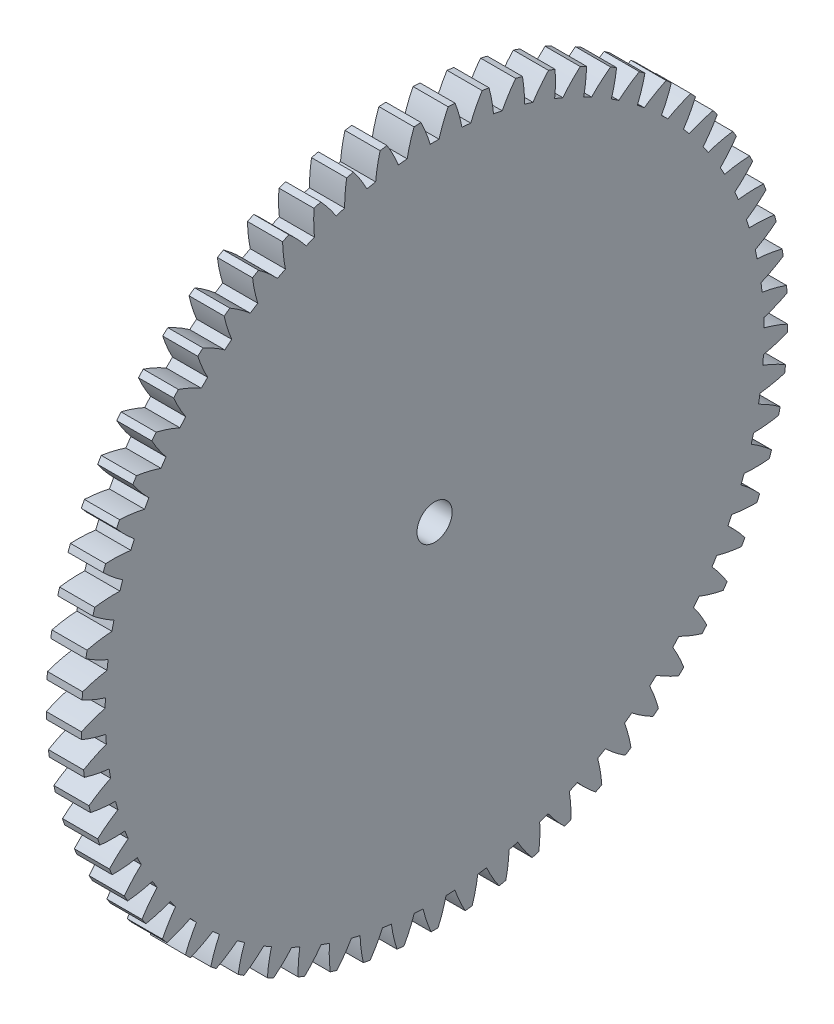
from build123d import *

# Parameters (mm, degrees)
BASPROSKE_W     = 5
BASPROSKE_H     = 50.25
TOOTHCUT_DEPTH  = 72.239911566
TEETHCUTS_COUNT = 65
TEETHCUTS_ANGLE = 354.461538462
BORSKE_R        = 2.5
BORE_DEPTH      = 50.0000508


with BuildPart() as part:
    # BasProSke → Base-Revolve (revolve)
    with BuildSketch(Plane(origin=(0, 0, 0), x_dir=(1, 0, 0), z_dir=(0, 1, 0))):
        with Locations((2.5, 25.125)):
            Rectangle(BASPROSKE_W, BASPROSKE_H)
    revolve(axis=Axis((-10, 0, 0), (1, 0, 0)))

    # TooCutSke → ToothCut (cut, through all)
    with BuildSketch(Plane(origin=(0, 0, 0), x_dir=(0, 0, -1), z_dir=(1, 0, 0))):
        with BuildLine():
            ThreePointArc((0.634247417, 46.869708834), (0, 46.874), (-0.634247417, 46.869708834))
            ThreePointArc((-0.634247417, 46.869708834), (-1.211889469, 48.584174321), (-1.945937979, 50.237726566))
            ThreePointArc((-1.945937979, 50.237726566), (0, 50.2754), (1.945937979, 50.237726566))
            ThreePointArc((1.945937979, 50.237726566), (1.211889469, 48.584174321), (0.634247417, 46.869708834))
        make_face()
    toothcut = extrude(amount=TOOTHCUT_DEPTH, mode=Mode.SUBTRACT)

    # TeethCuts: ToothCut ×65 about axis
    teethcuts_axis = Axis((-10, 0, 0), (1, 0, 0))
    for i in range(1, TEETHCUTS_COUNT):
        add(toothcut.rotate(teethcuts_axis, i * TEETHCUTS_ANGLE / (TEETHCUTS_COUNT - 1)), mode=Mode.SUBTRACT)

    # BorSke → Bore (cut, symmetric)
    with BuildSketch(Plane(origin=(0, 0, 0), x_dir=(0, 0, -1), z_dir=(1, 0, 0))):
        Circle(BORSKE_R)
    extrude(amount=BORE_DEPTH, both=True, mode=Mode.SUBTRACT)


solid = part.part
